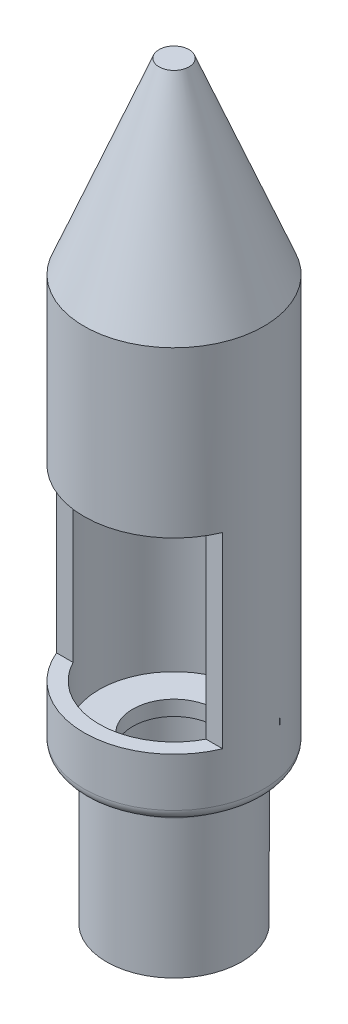
from build123d import *

# Parameters (mm, degrees)
SKETCH1_R               = 12
BOSS_EXTRUDE1_DEPTH     = 55
SKETCH2_R               = 2
SKETCH3_R               = 9
SKETCH3_R_2             = 7
BOSS_EXTRUDE2_DEPTH     = 20
SKETCH5_R               = 5.5
CUT_EXTRUDE2_DEPTH      = 4
SKETCH6_W               = 20
SKETCH6_H               = 25
CUT_EXTRUDE3_DEPTH      = 3
CUT_EXTRUDE4_DEPTH      = 85.380092576
CUT_EXTRUDE4_DEPTH_BACK = 85.380092576
SKETCH7_W               = 7.4
SKETCH7_H               = 25
FILLET1_R               = 1.5


# Read off the part's stored shape, not the designer's step: Shell1
with BuildPart() as part:
    # Sketch1 → Boss-Extrude1 (new body)
    with BuildSketch(Plane(origin=(0, 0, 0), x_dir=(1, 0, 0), z_dir=(0, 1, 0))):
        with Locations(Location((0, 0, 0), (0, 0, 270))):
            Circle(SKETCH1_R)
    extrude(amount=BOSS_EXTRUDE1_DEPTH)

    # Sketch2 → section 0 of loft1
    with BuildSketch(Plane(origin=(0, 80, 0), x_dir=(1, 0, 0), z_dir=(0, 1, 0)), mode=Mode.PRIVATE) as loft1_s0:
        Circle(SKETCH2_R)
    # loft up to a face of the part (loft1)
    loft([loft1_s0.sketch, Face(Wire([part.edges().sort_by_distance((8.747623529, 55, -8.214565271))[0]]))])

    # Shell1 outline → Shell1 (revolve, cut)
    with BuildSketch(Plane.XY):
        Polygon((10, 2), (10, 54.614835193), (0, 79.614835193), (0, 2), align=None)
    revolve(axis=Axis((0, 0, 0), (0, 1, 0)), mode=Mode.SUBTRACT)

    # Sketch3 → Boss-Extrude2 (add)
    with BuildSketch(Plane.XZ):
        with Locations(Location((0, 0, 0), (0, 0, 90))):
            Circle(SKETCH3_R)
        with Locations(Location((0, 0, 0), (0, 0, 270))):
            Circle(SKETCH3_R_2, mode=Mode.SUBTRACT)
    extrude(amount=BOSS_EXTRUDE2_DEPTH)

    # Sketch5 → Cut-Extrude2 (cut)
    with BuildSketch(Plane.XZ):
        with Locations(Location((0, 0, 0), (0, 0, 270))):
            Circle(SKETCH5_R)
    extrude(amount=-CUT_EXTRUDE2_DEPTH, mode=Mode.SUBTRACT)

    # Sketch6 → Cut-Extrude3 (cut, symmetric)
    with BuildSketch(Plane.XY.offset(11)):
        with Locations((0, 20.5)):
            Rectangle(SKETCH6_W, SKETCH6_H)
    extrude(amount=CUT_EXTRUDE3_DEPTH, both=True, mode=Mode.SUBTRACT)

    # Sketch7 → Cut-Extrude4 (cut, two sides: drawn at the far end of the back side and taken through both)
    with BuildSketch(Plane(origin=(-12, 0, 0), x_dir=(0, 0, -1), z_dir=(1, 0, 0)).offset(-CUT_EXTRUDE4_DEPTH_BACK)):
        with Locations((-8.3, 20.5)):
            Rectangle(SKETCH7_W, SKETCH7_H)
    extrude(amount=CUT_EXTRUDE4_DEPTH + CUT_EXTRUDE4_DEPTH_BACK, mode=Mode.SUBTRACT)

    # Fillet1
    fillet1_edges = [part.edges().sort_by_distance(p)[0] for p in [
        (0, 0, -9),
        (0, 0, -12),
    ]]
    fillet(fillet1_edges, radius=FILLET1_R - 0.0001)  # a hair under: the kernel refuses the full size


solid = part.part
